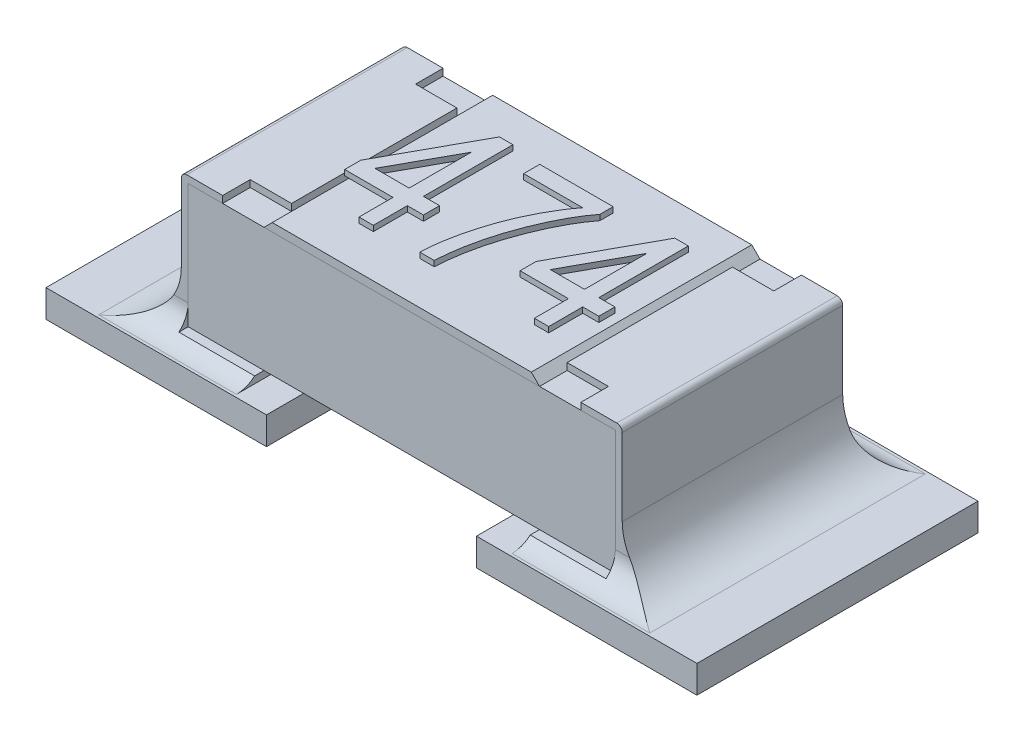
from build123d import *

# Parameters (mm, degrees)
SKETCH1_W             = 0.8
SKETCH1_H             = 0.45
BOSS_EXTRUDE1_DEPTH   = 0.775
BOSS_EXTRUDE2_DEPTH   = 0.4
BOSS_EXTRUDE2_2_DEPTH = 0.4
SKETCH3_W             = 0.15
SKETCH3_H             = 0.1
CUT_EXTRUDE1_DEPTH    = 0.025
BOSS_EXTRUDE3_DEPTH   = 0.4
SKETCH7_W             = 0.8
SKETCH7_H             = 1.02
BOSS_EXTRUDE5_DEPTH   = 0.1
FILLET3_R             = 0.2
FILLET4_R             = 0.2
FILLET5_R             = 0.1
FILLET6_R             = 0.1
BOSS_EXTRU_1_DEPTH    = 0.02


with BuildPart() as part:
    # Sketch1 → Boss-Extrude1 (new, symmetric)
    with BuildSketch(Plane(origin=(0, 0, 0), x_dir=(0, 0, -1), z_dir=(1, 0, 0))):
        with Locations((0, 0.35)):
            Rectangle(SKETCH1_W, SKETCH1_H)
    extrude(amount=BOSS_EXTRUDE1_DEPTH, both=True)


with BuildPart() as body_2:
    # Sketch2 → Boss-Extrude2 (new, symmetric)
    with BuildSketch(Plane.XY):
        with BuildLine():
            Line((-0.5, 0.6), (-0.78, 0.6))
            ThreePointArc((-0.78, 0.6), (-0.794142136, 0.594142136), (-0.8, 0.58))
            Line((-0.8, 0.58), (-0.8, 0.1))
            Line((-0.8, 0.1), (-0.5, 0.1))
            Line((-0.5, 0.1), (-0.5, 0.125))
            Line((-0.5, 0.125), (-0.775, 0.125))
            Line((-0.775, 0.125), (-0.775, 0.575))
            Line((-0.775, 0.575), (-0.5, 0.575))
            Line((-0.5, 0.575), (-0.5, 0.6))
        make_face()
    extrude(amount=BOSS_EXTRUDE2_DEPTH, both=True)


with BuildPart() as body_3:
    # Sketch2 → Boss-Extrude2 2 (new, symmetric)
    with BuildSketch(Plane.XY):
        with BuildLine():
            Line((0.5, 0.575), (0.5, 0.6))
            Line((0.5, 0.6), (0.78, 0.6))
            ThreePointArc((0.78, 0.6), (0.794142136, 0.594142136), (0.8, 0.58))
            Line((0.8, 0.58), (0.8, 0.1))
            Line((0.8, 0.1), (0.5, 0.1))
            Line((0.5, 0.1), (0.5, 0.125))
            Line((0.5, 0.125), (0.775, 0.125))
            Line((0.775, 0.125), (0.775, 0.575))
            Line((0.775, 0.575), (0.5, 0.575))
        make_face()
    extrude(amount=BOSS_EXTRUDE2_2_DEPTH, both=True)


with BuildPart() as cut_extrude1_tool:
    # Sketch3 → Cut-Extrude1 (new body)
    with BuildSketch(Plane(origin=(0, 0.6, 0), x_dir=(1, 0, 0), z_dir=(0, 1, 0))):
        with Locations((-0.575, 0.35)):
            Rectangle(SKETCH3_W, SKETCH3_H)
        with Locations((-0.575, -0.35)):
            Rectangle(SKETCH3_W, SKETCH3_H)
        with Locations((0.575, -0.35)):
            Rectangle(SKETCH3_W, SKETCH3_H)
        with Locations((0.575, 0.35)):
            Rectangle(SKETCH3_W, SKETCH3_H)
    extrude(amount=-CUT_EXTRUDE1_DEPTH)


with BuildPart() as body_2_1:
    add(body_2.part)

    # Cut-Extrude1: cut by cut_extrude1_tool
    add(cut_extrude1_tool.part, mode=Mode.SUBTRACT)



with BuildPart() as body_3_1:
    add(body_3.part)

    # Cut-Extrude1: cut by cut_extrude1_tool
    add(cut_extrude1_tool.part, mode=Mode.SUBTRACT)


with BuildPart() as body_4:
    # Sketch4 → Boss-Extrude3 (new, symmetric)
    with BuildSketch(Plane.XY):
        Polygon((-0.5, 0.575), (0.5, 0.575), (0.47, 0.605), (-0.47, 0.605), align=None)
    extrude(amount=BOSS_EXTRUDE3_DEPTH, both=True)

    # Esquisse2 → Boss.-Extru.1 (add)
    # profile 1 of 3: a face of its own
    with BuildSketch(Plane(origin=(0, 0.605, 0), x_dir=(1, 0, 0), z_dir=(0, 1, 0))):
        Polygon((-0.309886691, -0.245221888), (-0.309886691, -0.121845264), (-0.485211367, -0.121845264), (-0.485211367, -0.063403706), (-0.306944321, 0.261271619), (-0.257938639, 0.261271619), (-0.257938639, -0.063403706), (-0.199497081, -0.063403706), (-0.199497081, -0.121845264), (-0.257938639, -0.121845264), (-0.257938639, -0.245221888), align=None)
        Polygon((-0.309886691, -0.063403706), (-0.309886691, 0.162550028), (-0.433973542, -0.063403706), align=None, mode=Mode.SUBTRACT)
    # profile 2 of 3: a face of its own
    with BuildSketch(Plane(origin=(0, 0.605, 0), x_dir=(1, 0, 0), z_dir=(0, 1, 0))):
        with BuildLine():
            Line((-0.147549029, 0.189843048), (-0.147549029, 0.248284606))
            Line((-0.147549029, 0.248284606), (0.118684737, 0.248284606))
            Line((0.118684737, 0.248284606), (0.118684737, 0.200496457))
            add(Edge.make_bspline(
                [(0.118684737, 0.200496457), (0.11374506, 0.193883112), (0.103690577, 0.180421956), (0.089629665, 0.15888939), (0.075954824, 0.135956865), (0.062653235, 0.111604996), (0.049881166, 0.085755524), (0.037509723, 0.058489528), (0.02565439, 0.029704454), (0.014307924, -0.000233926), (0.003675417, -0.030854621), (-0.005742033, -0.061692329), (-0.013988634, -0.092449334), (-0.020962495, -0.123124227), (-0.026905964, -0.153701204), (-0.031550699, -0.184233606), (-0.035053075, -0.21472856), (-0.036458112, -0.235069144), (-0.037159418, -0.245221888)],
                knots=[0, 0, 0, 0, 0.828235292, 1.685834407, 2.579347319, 3.50739146, 4.469751317, 5.472290501, 6.511687755, 7.593421113, 8.685056077, 9.764080991, 10.828622054, 11.880069368, 12.920502423, 13.954003105, 14.978766756, 16, 16, 16, 16], degree=3))
            Line((-0.037159418, -0.245221888), (-0.08910747, -0.245221888))
            add(Edge.make_bspline(
                [(-0.08910747, -0.245221888), (-0.088946966, -0.239876054), (-0.088619538, -0.228970553), (-0.087305949, -0.2122975), (-0.085650055, -0.194926574), (-0.083168557, -0.176934464), (-0.080118357, -0.158294079), (-0.076411626, -0.13902896), (-0.072322113, -0.11904052), (-0.065773685, -0.091649168), (-0.056543919, -0.057339348), (-0.043279746, -0.016938754), (-0.028326509, 0.022538381), (-0.011308019, 0.060586243), (0.006839864, 0.096834643), (0.025951357, 0.13052881), (0.045471344, 0.161610603), (0.059774471, 0.180599823), (0.066736685, 0.189843048)],
                knots=[0, 0, 0, 0, 0.54755489, 1.117011975, 1.712111195, 2.334110413, 2.976306168, 3.645990646, 4.342828197, 5.06521062, 6.529487471, 7.979439287, 9.417531512, 10.850025522, 12.245424871, 13.566691952, 14.815558909, 16, 16, 16, 16], degree=3))
            Line((0.066736685, 0.189843048), (-0.147549029, 0.189843048))
        make_face()
    # profile 3 of 3: a face of its own
    with BuildSketch(Plane(origin=(0, 0.605, 0), x_dir=(1, 0, 0), z_dir=(0, 1, 0))):
        Polygon((0.326476945, -0.245221888), (0.326476945, -0.121845264), (0.15115227, -0.121845264), (0.15115227, -0.063403706), (0.329419315, 0.261271619), (0.378424997, 0.261271619), (0.378424997, -0.063403706), (0.436866556, -0.063403706), (0.436866556, -0.121845264), (0.378424997, -0.121845264), (0.378424997, -0.245221888), align=None)
        Polygon((0.326476945, -0.063403706), (0.326476945, 0.162550028), (0.202390094, -0.063403706), align=None, mode=Mode.SUBTRACT)
    extrude(amount=BOSS_EXTRU_1_DEPTH)


with BuildPart() as body_2_2:
    add(body_2_1.part)

    add(body_3_1.part)  # Boss-Extrude5 merges body 3
    # Sketch7 → Boss-Extrude5 (add)
    with BuildSketch(Plane(origin=(0, 0, 0), x_dir=(1, 0, 0), z_dir=(0, 1, 0))):
        with Locations((-0.781, 0)):
            Rectangle(SKETCH7_W, SKETCH7_H)
        with Locations((0.781, 0)):
            Rectangle(SKETCH7_W, SKETCH7_H)
    extrude(amount=BOSS_EXTRUDE5_DEPTH)

    # Fillet3
    fillet3_edges = [body_2_2.edges().sort_by_distance(p)[0] for p in [
        (-0.8, 0.1, 0),
    ]]
    fillet(fillet3_edges, radius=FILLET3_R)

    # Fillet4
    fillet4_edges = [body_2_2.edges().sort_by_distance(p)[0] for p in [
        (0.8, 0.1, 0),
    ]]
    fillet(fillet4_edges, radius=FILLET4_R)

    # Fillet5
    fillet5_edges = [body_2_2.edges().sort_by_distance(p)[0] for p in [
        (0.75, 0.1, 0.4),
    ]]
    fillet(fillet5_edges, radius=FILLET5_R)
    fillet5_2_edges = [body_2_2.edges().sort_by_distance(p)[0] for p in [
        (0.75, 0.1, -0.4),
    ]]
    fillet(fillet5_2_edges, radius=FILLET5_R)

    # Fillet6
    fillet6_edges = [body_2_2.edges().sort_by_distance(p)[0] for p in [
        (-0.75, 0.1, -0.4),
    ]]
    fillet(fillet6_edges, radius=FILLET6_R)
    fillet6_2_edges = [body_2_2.edges().sort_by_distance(p)[0] for p in [
        (-0.75, 0.1, 0.4),
    ]]
    fillet(fillet6_2_edges, radius=FILLET6_R)


solid = Compound([part.part, body_4.part, body_2_2.part])
